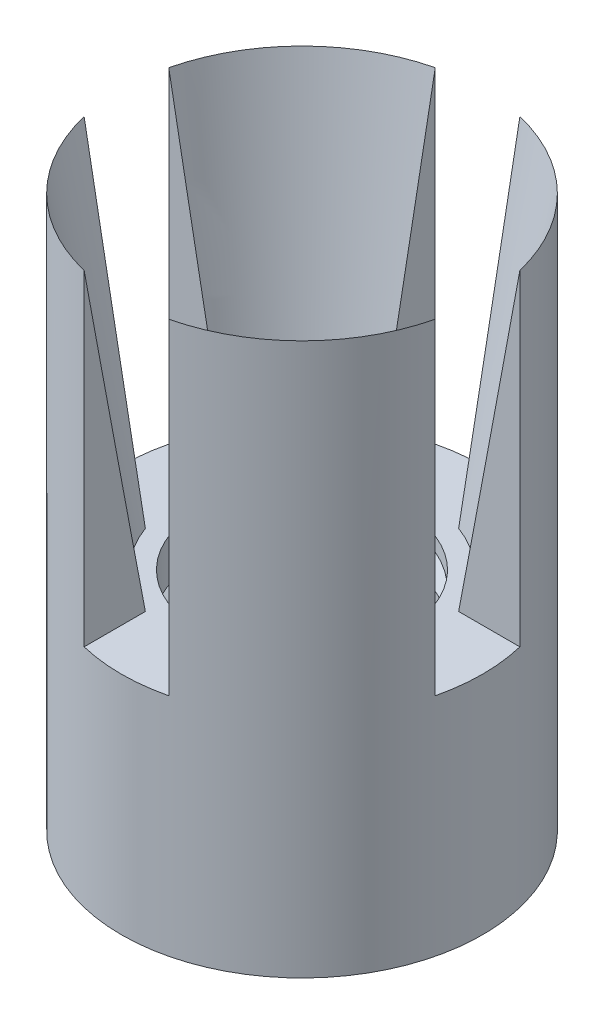
from build123d import *

# Parameters (mm, degrees)
SKETCH1_R               = 5.08
SKETCH1_R_2             = 2.8956
BOSS_EXTRUDE1_DEPTH     = 6.35
SKETCH2_R               = 5.08
BOSS_EXTRUDE2_DEPTH     = 12.7
CUT_EXTRUDE2_DEPTH      = 1.190625
SKETCH3_R               = 3.429
SKETCH4_R               = 5.715
CUT_EXTRUDE4_DEPTH      = 18.104156884
CUT_EXTRUDE4_DEPTH_BACK = 18.104156884
SKETCH8_W               = 2.38125
SKETCH8_H               = 17.43291786
CUT_EXTRUDE5_DEPTH      = 18.104156885
CUT_EXTRUDE5_DEPTH_BACK = 18.104156885
SKETCH9_W               = 2.38125
SKETCH9_H               = 17.756244475
THREAD1_PITCH           = 1.27


with BuildPart() as part:
    # Sketch1 → Boss-Extrude1 (new body)
    with BuildSketch(Plane(origin=(0, 0, 0), x_dir=(1, 0, 0), z_dir=(0, 1, 0))):
        with Locations(Location((0, 0, 0), (0, 0, 270))):
            Circle(SKETCH1_R)
        with Locations(Location((0, 0, 0), (0, 0, 270))):
            Circle(SKETCH1_R_2, mode=Mode.SUBTRACT)
    extrude(amount=BOSS_EXTRUDE1_DEPTH)

    # Sketch2 → Boss-Extrude2 (add)
    with BuildSketch(Plane(origin=(0, 6.35, 0), x_dir=(1, 0, 0), z_dir=(0, 1, 0))):
        with Locations(Location((0, 0, 0), (0, 0, 270))):
            Circle(SKETCH2_R)
    extrude(amount=BOSS_EXTRUDE2_DEPTH)

    # Sketch6 → Cut-Extrude2 (cut, symmetric)
    with BuildSketch(Plane.XY):
        Polygon((-5.715, 6.35), (-5.715, 19.05), (-3.17754, 6.35), align=None)
    extrude(amount=CUT_EXTRUDE2_DEPTH, both=True, mode=Mode.SUBTRACT)

    # Sketch3 → Cut-Loft2 section 0
    with BuildSketch(Plane(origin=(0, 6.35, 0), x_dir=(1, 0, 0), z_dir=(0, 1, 0))):
        Circle(SKETCH3_R)
    # Sketch4 → Cut-Loft2 section 1
    with BuildSketch(Plane(origin=(0, 19.05, 0), x_dir=(1, 0, 0), z_dir=(0, 1, 0))):
        Circle(SKETCH4_R)
    loft(mode=Mode.SUBTRACT)

    # Sketch8 → Cut-Extrude4 (cut, two sides: drawn at the far end of the back side and taken through both)
    with BuildSketch(Plane(origin=(0, 0, 0), x_dir=(0, 0, -1), z_dir=(1, 0, 0)).offset(-CUT_EXTRUDE4_DEPTH_BACK)):
        with Locations((0, 15.06645893)):
            Rectangle(SKETCH8_W, SKETCH8_H)
    extrude(amount=CUT_EXTRUDE4_DEPTH + CUT_EXTRUDE4_DEPTH_BACK, mode=Mode.SUBTRACT)

    # Sketch9 → Cut-Extrude5 (cut, two sides: drawn at the far end of the back side and taken through both)
    with BuildSketch(Plane.XY.offset(-CUT_EXTRUDE5_DEPTH_BACK)):
        with Locations((0, 15.228122238)):
            Rectangle(SKETCH9_W, SKETCH9_H)
    extrude(amount=CUT_EXTRUDE5_DEPTH + CUT_EXTRUDE5_DEPTH_BACK, mode=Mode.SUBTRACT)

    # Thread1: the profile of Thread Profile1 profile screwed along a right-hand helix of 5 turns, 8 arcs to a turn; built about Z, then put on its axis
    thread1_z = Axis((0, 0, 0), (0, 0, 1))
    thread1_corners = [(2.8953, 0, -0.000173205), (3.583007661, 0, 0.396874998), (3.583007661, 0, 0.555624998), (2.8953, 0, 0.952673202)]
    with BuildLine(mode=Mode.PRIVATE) as thread1_profile:
        Line(thread1_corners[0], thread1_corners[1])
        Line(thread1_corners[1], thread1_corners[2])
        Line(thread1_corners[2], thread1_corners[3])
        Line(thread1_corners[3], thread1_corners[0])
    thread1_cap = Face(thread1_profile.wire())
    thread1_turn_angles = [0, 22.5, 45, 67.5, 90, 112.5, 135, 157.5, 180, 202.5, 225, 247.5, 270, 292.5, 315, 337.5, 360]
    thread1_turn_weights = [1, 0.9238795325112867, 1, 0.9238795325112867, 1, 0.9238795325112867, 1, 0.9238795325112867, 1, 0.9238795325112867, 1, 0.9238795325112867, 1, 0.9238795325112867, 1, 0.9238795325112867, 1]
    thread1_turn_rails = [Edge.make_bspline([Vector(p[0], p[1], 0).rotate(thread1_z, thread1_turn_angles[k]) / thread1_turn_weights[k] + Vector(0, 0, p[2] + THREAD1_PITCH * thread1_turn_angles[k] / 360) for k in range(17)], [0, 0, 0, 1, 1, 2, 2, 3, 3, 4, 4, 5, 5, 6, 6, 7, 7, 8, 8, 8], 2, thread1_turn_weights) for p in thread1_corners]
    thread1_turn_sides = [Face.make_surface_from_curves(thread1_turn_rails[p[0]], thread1_turn_rails[p[1]]) for p in [(0, 1), (1, 2), (2, 3), (3, 0)]]
    thread1 = Plane(origin=(0, 6.35, 0), x_dir=(-1, 0, 0), z_dir=(0, -1, 0)) * Solid(Shell([*[p.moved(Location((0, 0, THREAD1_PITCH * i))) for i in range(5) for p in thread1_turn_sides], thread1_cap, thread1_cap.rotate(thread1_z, 1800).moved(Location((0, 0, THREAD1_PITCH * 1800 / 360)))]))
    add(thread1, mode=Mode.SUBTRACT)


solid = part.part
